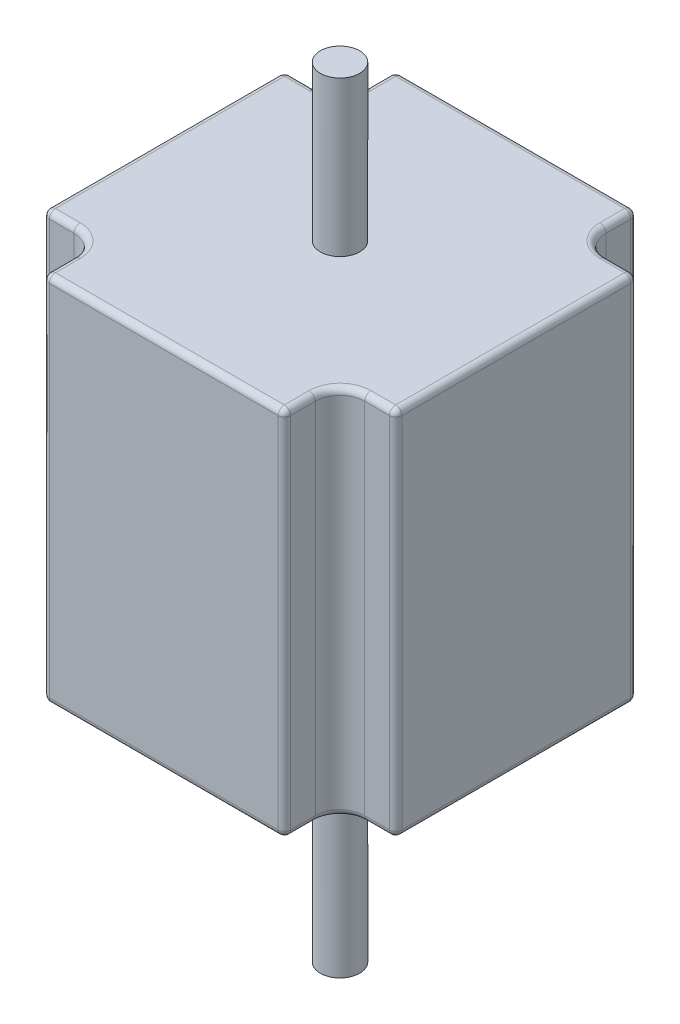
from build123d import *

# Parameters (mm, degrees)
SKETCH1_W                = 57
SKETCH1_H                = 57
EXTRUDE1_DEPTH           = 60
F_5_0_5_DIAMETER_HOLE1_D = 5
SKETCH6_R                = 4
SKETCH6_R_2              = 2.5
EXTRUDE4_DEPTH           = 71
FILLET1_R                = 1
EXTRUDE5_DEPTH           = 25
EXTRUDE5_DEPTH_BACK      = 101
SKETCH7_R                = 3.175
SKETCH8_R                = 15
EXTRUDE6_DEPTH           = 3
FILLET2_R                = 1


with BuildPart() as part:
    # Sketch1 → Extrude1 (new body)
    with BuildSketch(Plane(origin=(0, 0, 0), x_dir=(1, 0, 0), z_dir=(0, 1, 0))):
        Rectangle(SKETCH1_W, SKETCH1_H)
    extrude(amount=EXTRUDE1_DEPTH)

    # Ø5.0 (5) Diameter Hole1 (through all)
    with Locations(Plane.XZ):
        with Locations((-23.5, 23.5), (23.5, 23.5), (23.5, -23.5), (-23.5, -23.5)):
            Hole(F_5_0_5_DIAMETER_HOLE1_D / 2)

    # Sketch6 → Extrude4 (cut)
    # profile 1 of 12: a face of its own
    with BuildSketch(Plane(origin=(0, 60, 0), x_dir=(1, 0, 0), z_dir=(0, 1, 0))):
        Polygon((-28.5, 28.5), (-19.5, 28.5), (-19.5, 32.511741208), (-33.908905561, 32.511741208), (-33.908905561, 19.5), (-28.5, 19.5), align=None)
    # profile 2 of 12: a face of its own
    with BuildSketch(Plane(origin=(0, 60, 0), x_dir=(1, 0, 0), z_dir=(0, 1, 0))):
        with BuildLine():
            ThreePointArc((-23.5, 19.5), (-26.328427125, 26.328427125), (-19.5, 23.5))
            Line((-19.5, 23.5), (-19.5, 28.5))
            Line((-19.5, 28.5), (-28.5, 28.5))
            Line((-28.5, 28.5), (-28.5, 19.5))
            Line((-28.5, 19.5), (-23.5, 19.5))
        make_face()
    # profile 3 of 12: a face of its own
    with BuildSketch(Plane(origin=(0, 60, 0), x_dir=(1, 0, 0), z_dir=(0, 1, 0))):
        with Locations((-23.5, 23.5)):
            Circle(SKETCH6_R)
        with Locations((-23.5, 23.5)):
            Circle(SKETCH6_R_2, mode=Mode.SUBTRACT)
    # profile 4 of 12: a face of its own
    with BuildSketch(Plane(origin=(0, 60, 0), x_dir=(1, 0, 0), z_dir=(0, 1, 0))):
        Polygon((19.5, 36.471560472), (19.5, 28.5), (28.5, 28.5), (28.5, 19.5), (41.168352552, 19.5), (41.168352552, 36.471560472), align=None)
    # profile 5 of 12: a face of its own
    with BuildSketch(Plane(origin=(0, 60, 0), x_dir=(1, 0, 0), z_dir=(0, 1, 0))):
        with BuildLine():
            Line((28.5, 28.5), (19.5, 28.5))
            Line((19.5, 28.5), (19.5, 23.5))
            ThreePointArc((19.5, 23.5), (23.5, 27.5), (27.5, 23.5))
            ThreePointArc((27.5, 23.5), (26.328427125, 20.671572875), (23.5, 19.5))
            Line((23.5, 19.5), (28.5, 19.5))
            Line((28.5, 19.5), (28.5, 28.5))
        make_face()
    # profile 6 of 12: a face of its own
    with BuildSketch(Plane(origin=(0, 60, 0), x_dir=(1, 0, 0), z_dir=(0, 1, 0))):
        with Locations((23.5, 23.5)):
            Circle(SKETCH6_R)
        with Locations((23.5, 23.5)):
            Circle(SKETCH6_R_2, mode=Mode.SUBTRACT)
    # profile 7 of 12: a face of its own
    with BuildSketch(Plane(origin=(0, 60, 0), x_dir=(1, 0, 0), z_dir=(0, 1, 0))):
        with Locations((23.5, -23.5)):
            Circle(SKETCH6_R)
        with Locations((23.5, -23.5)):
            Circle(SKETCH6_R_2, mode=Mode.SUBTRACT)
    # profile 8 of 12: a face of its own
    with BuildSketch(Plane(origin=(0, 60, 0), x_dir=(1, 0, 0), z_dir=(0, 1, 0))):
        with BuildLine():
            Line((28.5, -28.5), (28.5, -19.5))
            Line((28.5, -19.5), (23.5, -19.5))
            ThreePointArc((23.5, -19.5), (26.328427125, -20.671572875), (27.5, -23.5))
            ThreePointArc((27.5, -23.5), (23.5, -27.5), (19.5, -23.5))
            Line((19.5, -23.5), (19.5, -28.5))
            Line((19.5, -28.5), (28.5, -28.5))
        make_face()
    # profile 9 of 12: a face of its own
    with BuildSketch(Plane(origin=(0, 60, 0), x_dir=(1, 0, 0), z_dir=(0, 1, 0))):
        Polygon((44.252209519, -19.5), (28.5, -19.5), (28.5, -28.5), (19.5, -28.5), (19.5, -40.050429997), (44.252209519, -40.050429997), align=None)
    # profile 10 of 12: a face of its own
    with BuildSketch(Plane(origin=(0, 60, 0), x_dir=(1, 0, 0), z_dir=(0, 1, 0))):
        Polygon((-28.5, -28.5), (-28.5, -19.5), (-37.670786859, -19.5), (-37.670786859, -37.828231874), (-19.5, -37.828231874), (-19.5, -28.5), align=None)
    # profile 11 of 12: a face of its own
    with BuildSketch(Plane(origin=(0, 60, 0), x_dir=(1, 0, 0), z_dir=(0, 1, 0))):
        with BuildLine():
            Line((-23.5, -19.5), (-28.5, -19.5))
            Line((-28.5, -19.5), (-28.5, -28.5))
            Line((-28.5, -28.5), (-19.5, -28.5))
            Line((-19.5, -28.5), (-19.5, -23.5))
            ThreePointArc((-19.5, -23.5), (-26.328427125, -26.328427125), (-23.5, -19.5))
        make_face()
    # profile 12 of 12: a face of its own
    with BuildSketch(Plane(origin=(0, 60, 0), x_dir=(1, 0, 0), z_dir=(0, 1, 0))):
        with Locations((-23.5, -23.5)):
            Circle(SKETCH6_R)
        with Locations((-23.5, -23.5)):
            Circle(SKETCH6_R_2, mode=Mode.SUBTRACT)
    extrude(amount=-EXTRUDE4_DEPTH, mode=Mode.SUBTRACT)

    # Fillet1
    fillet1_edges = [part.edges().sort_by_distance(p)[0] for p in [
        (0, 0, 28.5),
        (-20.671572875, 0, 20.671572875),
        (-19.5, 0, 26),
        (-26, 0, 19.5),
        (-28.5, 0, 0),
        (-20.671572875, 0, -20.671572875),
        (-19.5, 0, -26),
        (-26, 0, -19.5),
        (0, 0, -28.5),
        (20.671572875, 0, -20.671572875),
        (26, 0, -19.5),
        (19.5, 0, -26),
        (28.5, 0, 0),
        (20.671572875, 0, 20.671572875),
        (26, 0, 19.5),
        (19.5, 0, 26),
    ]]
    fillet(fillet1_edges, radius=FILLET1_R)



with BuildPart() as body_2:
    # Sketch7 → Extrude5 (new, two sides: drawn at the far end of the back side and taken through both)
    with BuildSketch(Plane(origin=(0, 60, 0), x_dir=(1, 0, 0), z_dir=(0, 1, 0)).offset(-EXTRUDE5_DEPTH_BACK)):
        with Locations(Location((0, 0, 0), (0, 0, 270))):
            Circle(SKETCH7_R)
    extrude(amount=EXTRUDE5_DEPTH + EXTRUDE5_DEPTH_BACK)


with BuildPart() as part_1:
    add(part.part)

    add(body_2.part)  # Extrude6 merges body 2
    # Sketch8 → Extrude6 (add)
    with BuildSketch(Plane.XZ):
        with Locations(Location((0, 0, 0), (0, 0, 270))):
            Circle(SKETCH8_R)
    extrude(amount=EXTRUDE6_DEPTH)

    # Fillet2
    # the kernel refuses this fillet: 1 mm, written as the material it takes off along each edge
    with BuildSketch(Plane(origin=(27.5, 1, -18.5), x_dir=(0, 0, -1), z_dir=(1, 0, 0))) as fillet2_piece_1_section:
        Polygon((0, 0), (FILLET2_R, 0), (FILLET2_R, -FILLET2_R), (0, -FILLET2_R), align=None)
    fillet2_piece_1 = extrude(amount=FILLET2_R, mode=Mode.PRIVATE)
    fillet2_piece_1 = fillet2_piece_1 - Plane(origin=(27.5, 1, -18.5), x_dir=(0, 0.7071067811865475, 0.7071067811865475), z_dir=(1, 0, 0)) * Sphere(FILLET2_R, mode=Mode.PRIVATE)
    add(fillet2_piece_1, mode=Mode.SUBTRACT)
    with BuildSketch(Plane(origin=(27.5, 1, 18.5), x_dir=(1, 0, 0), z_dir=(0, 0, 1))) as fillet2_piece_2_section:
        Polygon((0, 0), (FILLET2_R, 0), (FILLET2_R, -FILLET2_R), (0, -FILLET2_R), align=None)
    fillet2_piece_2 = extrude(amount=FILLET2_R, mode=Mode.PRIVATE)
    fillet2_piece_2 = fillet2_piece_2 - Plane(origin=(27.5, 1, 18.5), x_dir=(-0.7071067811865475, 0.7071067811865475, 0), z_dir=(0, 0, 1)) * Sphere(FILLET2_R, mode=Mode.PRIVATE)
    add(fillet2_piece_2, mode=Mode.SUBTRACT)
    with BuildSketch(Plane(origin=(18.5, 1, -27.5), x_dir=(1, 0, 0), z_dir=(0, 0, -1))) as fillet2_piece_3_section:
        Polygon((0, 0), (FILLET2_R, 0), (FILLET2_R, FILLET2_R), (0, FILLET2_R), align=None)
    fillet2_piece_3 = extrude(amount=FILLET2_R, mode=Mode.PRIVATE)
    fillet2_piece_3 = fillet2_piece_3 - Plane(origin=(18.5, 1, -27.5), x_dir=(-0.7071067811865475, 0.7071067811865475, 0), z_dir=(0, 0, -1)) * Sphere(FILLET2_R, mode=Mode.PRIVATE)
    add(fillet2_piece_3, mode=Mode.SUBTRACT)
    with BuildSketch(Plane(origin=(-18.5, 1, -27.5), x_dir=(0, 0, -1), z_dir=(-1, 0, 0))) as fillet2_piece_4_section:
        Polygon((0, 0), (FILLET2_R, 0), (FILLET2_R, FILLET2_R), (0, FILLET2_R), align=None)
    fillet2_piece_4 = extrude(amount=FILLET2_R, mode=Mode.PRIVATE)
    fillet2_piece_4 = fillet2_piece_4 - Plane(origin=(-18.5, 1, -27.5), x_dir=(0, 0.7071067811865475, 0.7071067811865475), z_dir=(-1, 0, 0)) * Sphere(FILLET2_R, mode=Mode.PRIVATE)
    add(fillet2_piece_4, mode=Mode.SUBTRACT)
    with BuildSketch(Plane(origin=(18.5, 1, 27.5), x_dir=(1, 0, 0), z_dir=(0, 0, 1))) as fillet2_piece_5_section:
        Polygon((0, 0), (FILLET2_R, 0), (FILLET2_R, -FILLET2_R), (0, -FILLET2_R), align=None)
    fillet2_piece_5 = extrude(amount=FILLET2_R, mode=Mode.PRIVATE)
    fillet2_piece_5 = fillet2_piece_5 - Plane(origin=(18.5, 1, 27.5), x_dir=(-0.7071067811865475, 0.7071067811865475, 0), z_dir=(0, 0, 1)) * Sphere(FILLET2_R, mode=Mode.PRIVATE)
    add(fillet2_piece_5, mode=Mode.SUBTRACT)
    with BuildSketch(Plane(origin=(-18.5, 1, 27.5), x_dir=(-1, 0, 0), z_dir=(0, 0, 1))) as fillet2_piece_6_section:
        Polygon((0, 0), (FILLET2_R, 0), (FILLET2_R, FILLET2_R), (0, FILLET2_R), align=None)
    fillet2_piece_6 = extrude(amount=FILLET2_R, mode=Mode.PRIVATE)
    fillet2_piece_6 = fillet2_piece_6 - Plane(origin=(-18.5, 1, 27.5), x_dir=(0.7071067811865475, 0.7071067811865475, 0), z_dir=(0, 0, 1)) * Sphere(FILLET2_R, mode=Mode.PRIVATE)
    add(fillet2_piece_6, mode=Mode.SUBTRACT)
    with BuildSketch(Plane(origin=(-27.5, 1, -18.5), x_dir=(0, 0, -1), z_dir=(-1, 0, 0))) as fillet2_piece_7_section:
        Polygon((0, 0), (FILLET2_R, 0), (FILLET2_R, FILLET2_R), (0, FILLET2_R), align=None)
    fillet2_piece_7 = extrude(amount=FILLET2_R, mode=Mode.PRIVATE)
    fillet2_piece_7 = fillet2_piece_7 - Plane(origin=(-27.5, 1, -18.5), x_dir=(0, 0.7071067811865475, 0.7071067811865475), z_dir=(-1, 0, 0)) * Sphere(FILLET2_R, mode=Mode.PRIVATE)
    add(fillet2_piece_7, mode=Mode.SUBTRACT)
    with BuildSketch(Plane(origin=(-27.5, 1, 18.5), x_dir=(-1, 0, 0), z_dir=(0, 0, 1))) as fillet2_piece_8_section:
        Polygon((0, 0), (FILLET2_R, 0), (FILLET2_R, FILLET2_R), (0, FILLET2_R), align=None)
    fillet2_piece_8 = extrude(amount=FILLET2_R, mode=Mode.PRIVATE)
    fillet2_piece_8 = fillet2_piece_8 - Plane(origin=(-27.5, 1, 18.5), x_dir=(0.7071067811865475, 0.7071067811865475, 0), z_dir=(0, 0, 1)) * Sphere(FILLET2_R, mode=Mode.PRIVATE)
    add(fillet2_piece_8, mode=Mode.SUBTRACT)
    with BuildSketch(Plane(origin=(-18.5, 59, 27.5), x_dir=(0, 1, 0), z_dir=(0, 0, 1))) as fillet2_piece_9_section:
        Polygon((0, 0), (FILLET2_R, 0), (FILLET2_R, FILLET2_R), (0, FILLET2_R), align=None)
    fillet2_piece_9 = extrude(amount=FILLET2_R, mode=Mode.PRIVATE)
    fillet2_piece_9 = fillet2_piece_9 - Plane(origin=(-18.5, 59, 27.5), x_dir=(0.7071067811865475, -0.7071067811865475, 0), z_dir=(0, 0, 1)) * Sphere(FILLET2_R, mode=Mode.PRIVATE)
    add(fillet2_piece_9, mode=Mode.SUBTRACT)
    with BuildSketch(Plane(origin=(18.5, 59, 27.5), x_dir=(1, 0, 0), z_dir=(0, 0, 1))) as fillet2_piece_10_section:
        Polygon((0, 0), (FILLET2_R, 0), (FILLET2_R, FILLET2_R), (0, FILLET2_R), align=None)
    fillet2_piece_10 = extrude(amount=FILLET2_R, mode=Mode.PRIVATE)
    fillet2_piece_10 = fillet2_piece_10 - Plane(origin=(18.5, 59, 27.5), x_dir=(-0.7071067811865475, -0.7071067811865475, 0), z_dir=(0, 0, 1)) * Sphere(FILLET2_R, mode=Mode.PRIVATE)
    add(fillet2_piece_10, mode=Mode.SUBTRACT)
    with BuildSketch(Plane(origin=(-27.5, 59, 18.5), x_dir=(0, 0, 1), z_dir=(-1, 0, 0))) as fillet2_piece_11_section:
        Polygon((0, 0), (FILLET2_R, 0), (FILLET2_R, FILLET2_R), (0, FILLET2_R), align=None)
    fillet2_piece_11 = extrude(amount=FILLET2_R, mode=Mode.PRIVATE)
    fillet2_piece_11 = fillet2_piece_11 - Plane(origin=(-27.5, 59, 18.5), x_dir=(0, -0.7071067811865475, -0.7071067811865475), z_dir=(-1, 0, 0)) * Sphere(FILLET2_R, mode=Mode.PRIVATE)
    add(fillet2_piece_11, mode=Mode.SUBTRACT)
    with BuildSketch(Plane(origin=(27.5, 59, 18.5), x_dir=(0, 0, 1), z_dir=(0, 1, 0))) as fillet2_piece_12_section:
        Polygon((0, 0), (FILLET2_R, 0), (FILLET2_R, FILLET2_R), (0, FILLET2_R), align=None)
    fillet2_piece_12 = extrude(amount=FILLET2_R, mode=Mode.PRIVATE)
    fillet2_piece_12 = fillet2_piece_12 - Plane(origin=(27.5, 59, 18.5), x_dir=(-0.7071067811865475, 0, -0.7071067811865475), z_dir=(0, 1, 0)) * Sphere(FILLET2_R, mode=Mode.PRIVATE)
    add(fillet2_piece_12, mode=Mode.SUBTRACT)
    with BuildSketch(Plane(origin=(18.5, 59, -27.5), x_dir=(0, 0, -1), z_dir=(0, 1, 0))) as fillet2_piece_13_section:
        Polygon((0, 0), (FILLET2_R, 0), (FILLET2_R, -FILLET2_R), (0, -FILLET2_R), align=None)
    fillet2_piece_13 = extrude(amount=FILLET2_R, mode=Mode.PRIVATE)
    fillet2_piece_13 = fillet2_piece_13 - Plane(origin=(18.5, 59, -27.5), x_dir=(-0.7071067811865475, 0, 0.7071067811865475), z_dir=(0, 1, 0)) * Sphere(FILLET2_R, mode=Mode.PRIVATE)
    add(fillet2_piece_13, mode=Mode.SUBTRACT)
    with BuildSketch(Plane(origin=(-18.5, 59, -27.5), x_dir=(-1, 0, 0), z_dir=(0, 1, 0))) as fillet2_piece_14_section:
        Polygon((0, 0), (FILLET2_R, 0), (FILLET2_R, -FILLET2_R), (0, -FILLET2_R), align=None)
    fillet2_piece_14 = extrude(amount=FILLET2_R, mode=Mode.PRIVATE)
    fillet2_piece_14 = fillet2_piece_14 - Plane(origin=(-18.5, 59, -27.5), x_dir=(0.7071067811865475, 0, 0.7071067811865475), z_dir=(0, 1, 0)) * Sphere(FILLET2_R, mode=Mode.PRIVATE)
    add(fillet2_piece_14, mode=Mode.SUBTRACT)
    with BuildSketch(Plane(origin=(-27.5, 59, -18.5), x_dir=(0, 1, 0), z_dir=(-1, 0, 0))) as fillet2_piece_15_section:
        Polygon((0, 0), (FILLET2_R, 0), (FILLET2_R, FILLET2_R), (0, FILLET2_R), align=None)
    fillet2_piece_15 = extrude(amount=FILLET2_R, mode=Mode.PRIVATE)
    fillet2_piece_15 = fillet2_piece_15 - Plane(origin=(-27.5, 59, -18.5), x_dir=(0, -0.7071067811865475, 0.7071067811865475), z_dir=(-1, 0, 0)) * Sphere(FILLET2_R, mode=Mode.PRIVATE)
    add(fillet2_piece_15, mode=Mode.SUBTRACT)
    with BuildSketch(Plane(origin=(27.5, 59, -18.5), x_dir=(0, 1, 0), z_dir=(0, 0, -1))) as fillet2_piece_16_section:
        Polygon((0, 0), (FILLET2_R, 0), (FILLET2_R, FILLET2_R), (0, FILLET2_R), align=None)
    fillet2_piece_16 = extrude(amount=FILLET2_R, mode=Mode.PRIVATE)
    fillet2_piece_16 = fillet2_piece_16 - Plane(origin=(27.5, 59, -18.5), x_dir=(-0.7071067811865475, -0.7071067811865475, 0), z_dir=(0, 0, -1)) * Sphere(FILLET2_R, mode=Mode.PRIVATE)
    add(fillet2_piece_16, mode=Mode.SUBTRACT)
    with BuildSketch(Plane(origin=(-18.5, 60, 28.5), x_dir=(0, -1, 0), z_dir=(1, 0, 0))) as fillet2_piece_17:
        with BuildLine():
            CenterArc((FILLET2_R, FILLET2_R), FILLET2_R, 180, 90)
            Line((0, FILLET2_R), (0, 0))
            Line((0, 0), (FILLET2_R, 0))
        make_face()
    extrude(amount=37, mode=Mode.SUBTRACT)
    with BuildSketch(Plane(origin=(-19.5, 59, 28.5), x_dir=(1, 0, 0), z_dir=(0, -1, 0)), Plane(origin=(19.5, 59, -28.5), x_dir=(-1, 0, 0), z_dir=(0, -1, 0)), Plane(origin=(-28.5, 59, -19.5), x_dir=(0, 0, 1), z_dir=(0, -1, 0)), Plane(origin=(28.5, 1, -19.5), x_dir=(0, 0, 1), z_dir=(0, 1, 0)), Plane(origin=(19.5, 1, 28.5), x_dir=(-1, 0, 0), z_dir=(0, 1, 0))) as fillet2_piece_18:
        with BuildLine():
            CenterArc((FILLET2_R, -FILLET2_R), FILLET2_R, 90, 90)
            Line((0, -FILLET2_R), (0, 0))
            Line((0, 0), (FILLET2_R, 0))
        make_face()
    extrude(amount=58, mode=Mode.SUBTRACT)
    with BuildSketch(Plane(origin=(-19.5, 60, 27.5), x_dir=(1, 0, 0), z_dir=(0, 0, -1)), Plane(origin=(-27.5, 60, -19.5), x_dir=(0, 0, 1), z_dir=(1, 0, 0)), Plane(origin=(23.5, 60, -19.5), x_dir=(0, 0, 1), z_dir=(1, 0, 0)), Plane(origin=(27.5, 60, 19.5), x_dir=(0, 0, -1), z_dir=(-1, 0, 0))) as fillet2_piece_19:
        with BuildLine():
            CenterArc((FILLET2_R, FILLET2_R), FILLET2_R, 180, 90)
            Line((0, FILLET2_R), (0, 0))
            Line((0, 0), (FILLET2_R, 0))
        make_face()
    extrude(amount=4, mode=Mode.SUBTRACT)
    with BuildSketch(Plane(origin=(-23.5, 60, 23.5), x_dir=(1, 0, 0), z_dir=(0, 0, 1))) as fillet2_piece_20:
        with BuildLine():
            CenterArc((4 + FILLET2_R, -FILLET2_R), FILLET2_R, 90, 90)
            Line((4, -FILLET2_R), (4, 0))
            Line((4, 0), (4 + FILLET2_R, 0))
        make_face()
    revolve(axis=Axis((-23.5, 60, 23.5), (0, 1, 0)), revolution_arc=90, mode=Mode.SUBTRACT)
    with BuildSketch(Plane(origin=(-27.5, 60, 19.5), x_dir=(0, 0, -1), z_dir=(1, 0, 0)), Plane(origin=(-19.5, 60, -27.5), x_dir=(1, 0, 0), z_dir=(0, 0, 1)), Plane(origin=(19.5, 60, -23.5), x_dir=(-1, 0, 0), z_dir=(0, 0, -1)), Plane(origin=(19.5, 60, 23.5), x_dir=(0, -1, 0), z_dir=(0, 0, 1))) as fillet2_piece_21:
        with BuildLine():
            CenterArc((FILLET2_R, -FILLET2_R), FILLET2_R, 90, 90)
            Line((0, -FILLET2_R), (0, 0))
            Line((0, 0), (FILLET2_R, 0))
        make_face()
    extrude(amount=4, mode=Mode.SUBTRACT)
    with BuildSketch(Plane(origin=(-28.5, 1, 19.5), x_dir=(1, 0, 0), z_dir=(0, 1, 0)), Plane(origin=(28.5, 59, 19.5), x_dir=(-1, 0, 0), z_dir=(0, -1, 0)), Plane(origin=(-19.5, 1, -28.5), x_dir=(0, 0, 1), z_dir=(0, 1, 0))) as fillet2_piece_22:
        with BuildLine():
            CenterArc((FILLET2_R, FILLET2_R), FILLET2_R, 180, 90)
            Line((0, FILLET2_R), (0, 0))
            Line((0, 0), (FILLET2_R, 0))
        make_face()
    extrude(amount=58, mode=Mode.SUBTRACT)
    with BuildSketch(Plane(origin=(-28.5, 60, -18.5), x_dir=(1, 0, 0), z_dir=(0, 0, 1)), Plane(origin=(18.5, 60, -28.5), x_dir=(0, 0, 1), z_dir=(-1, 0, 0)), Plane(origin=(28.5, 60, 18.5), x_dir=(-1, 0, 0), z_dir=(0, 0, -1))) as fillet2_piece_23:
        with BuildLine():
            CenterArc((FILLET2_R, -FILLET2_R), FILLET2_R, 90, 90)
            Line((0, -FILLET2_R), (0, 0))
            Line((0, 0), (FILLET2_R, 0))
        make_face()
    extrude(amount=37, mode=Mode.SUBTRACT)
    with BuildSketch(Plane(origin=(-23.5, 60, -23.5), x_dir=(0, 0, 1), z_dir=(-1, 0, 0))) as fillet2_piece_24:
        with BuildLine():
            CenterArc((4 + FILLET2_R, -FILLET2_R), FILLET2_R, 90, 90)
            Line((4, -FILLET2_R), (4, 0))
            Line((4, 0), (4 + FILLET2_R, 0))
        make_face()
    revolve(axis=Axis((-23.5, 60, -23.5), (0, 1, 0)), revolution_arc=90, mode=Mode.SUBTRACT)
    with BuildSketch(Plane(origin=(23.5, 60, -23.5), x_dir=(-1, 0, 0), z_dir=(0, 0, -1))) as fillet2_piece_25:
        with BuildLine():
            CenterArc((4 + FILLET2_R, -FILLET2_R), FILLET2_R, 90, 90)
            Line((4, -FILLET2_R), (4, 0))
            Line((4, 0), (4 + FILLET2_R, 0))
        make_face()
    revolve(axis=Axis((23.5, 60, -23.5), (0, 1, 0)), revolution_arc=90, mode=Mode.SUBTRACT)
    with BuildSketch(Plane(origin=(23.5, 60, 23.5), x_dir=(0, 0, -1), z_dir=(1, 0, 0))) as fillet2_piece_26:
        with BuildLine():
            CenterArc((4 + FILLET2_R, -FILLET2_R), FILLET2_R, 90, 90)
            Line((4, -FILLET2_R), (4, 0))
            Line((4, 0), (4 + FILLET2_R, 0))
        make_face()
    revolve(axis=Axis((23.5, 60, 23.5), (0, 1, 0)), revolution_arc=90, mode=Mode.SUBTRACT)


solid = part_1.part
